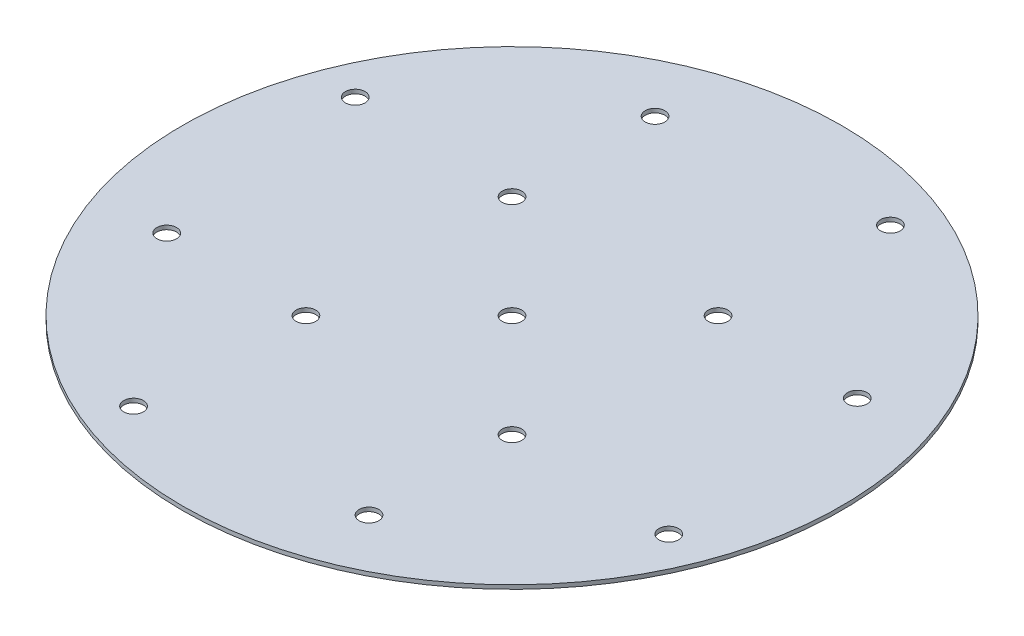
from build123d import *

# Parameters (mm, degrees)
SKETCH2_W                    = 82.55
SKETCH2_H                    = 1
F_10_0_1935_DIAMETER_HOLE1_D = 4.9149
CIRPATTERN3_COUNT            = 4
F_10_0_1935_DIAMETER_HOLE2_D = 4.9149


with BuildPart() as part:
    # Sketch2 → Revolve1 (revolve)
    with BuildSketch(Plane(origin=(0, 0, 0), x_dir=(0, 0, -1), z_dir=(1, 0, 0))):
        with Locations((-41.275, 0.5)):
            Rectangle(SKETCH2_W, SKETCH2_H)
    revolve(axis=Axis((0, -0.05, 0), (0, 1, 0)))

    # #10 (0.1935) Diameter Hole1 (through all)
    with Locations(Plane(origin=(0, 1, 0), x_dir=(1, 0, 0), z_dir=(0, 1, 0))):
        with Locations((-25.333643223, 61.160825052), (264.743675233, 73.787758551), (-67.027460084, 27.763683018), (-25.809397513, 25.809397513)):
            f_10_0_1935_diameter_hole1 = Hole(F_10_0_1935_DIAMETER_HOLE1_D / 2)

    # CirPattern3: #10 (0.1935) Diameter Hole1 ×4 about axis
    cirpattern3_axis = Axis((0, -0.05, 0), (0, 1, 0))
    for i in range(1, CIRPATTERN3_COUNT):
        add(f_10_0_1935_diameter_hole1.rotate(cirpattern3_axis, i * 360 / CIRPATTERN3_COUNT), mode=Mode.SUBTRACT)

    # #10 (0.1935) Diameter Hole2 (through all)
    with Locations(Plane(origin=(0, 1, 0), x_dir=(1, 0, 0), z_dir=(0, 1, 0))):
        with Locations((0, 0)):
            Hole(F_10_0_1935_DIAMETER_HOLE2_D / 2)


solid = part.part
